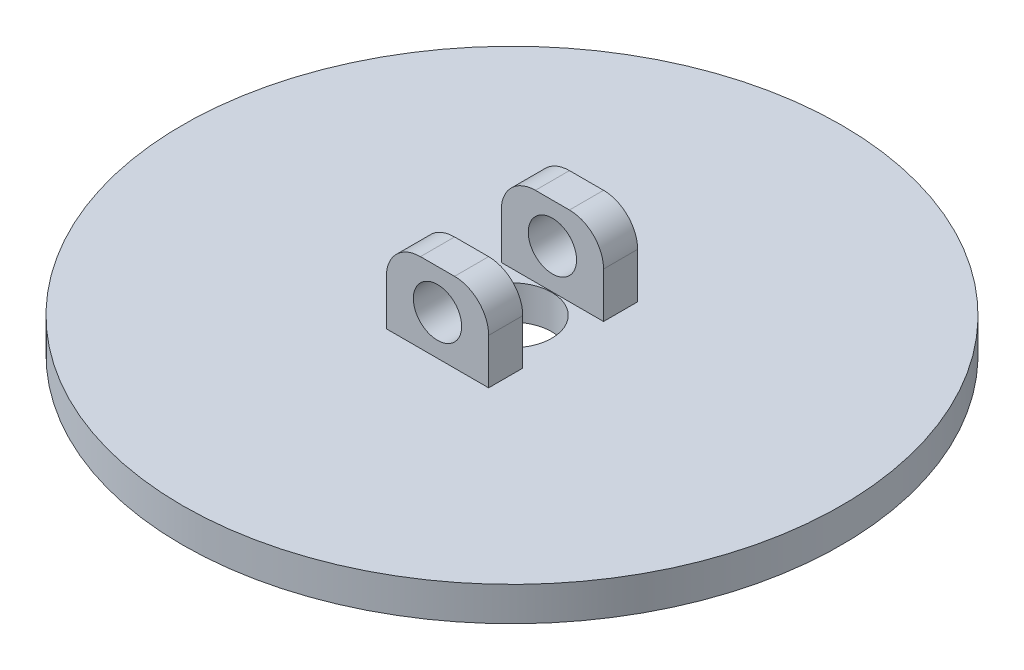
from build123d import *

# Parameters (mm, degrees)
SKETCH1_R               = 29
SKETCH1_R_2             = 3.5
BOSS_EXTRUDE1_DEPTH     = 3
SKETCH2_W               = 9
SKETCH2_H               = 3
BOSS_EXTRUDE2_DEPTH     = 7
CUT_EXTRUDE1_DEPTH      = 43.213741838
CUT_EXTRUDE1_DEPTH_BACK = 43.213741838
SKETCH4_R               = 2.125
CUT_EXTRUDE4_START      = -6.555610355
CUT_EXTRUDE4_DEPTH      = 13.11122071


# Read off the part's stored shape, not the designer's step: Cut-Extrude4
with BuildPart() as part:
    # Sketch1 → Boss-Extrude1 (new body)
    with BuildSketch(Plane(origin=(0, 0, 0), x_dir=(1, 0, 0), z_dir=(0, 1, 0))):
        with Locations(Location((0, 0, 0), (0, 0, 270))):
            Circle(SKETCH1_R)
        with Locations(Location((0, 0, 0), (0, 0, 270))):
            Circle(SKETCH1_R_2, mode=Mode.SUBTRACT)
    extrude(amount=BOSS_EXTRUDE1_DEPTH)

    # Sketch2 → Boss-Extrude2 (add)
    with BuildSketch(Plane(origin=(0, 3, 0), x_dir=(1, 0, 0), z_dir=(0, 1, 0))):
        with Locations((0, 5.055610355)):
            Rectangle(SKETCH2_W, SKETCH2_H)
        with Locations((0, -5.055610355)):
            Rectangle(SKETCH2_W, SKETCH2_H)
    extrude(amount=BOSS_EXTRUDE2_DEPTH)

    # Sketch4 → Cut-Extrude1 (cut, two sides: drawn at the far end of the back side and taken through both)
    with BuildSketch(Plane.XY.offset(-CUT_EXTRUDE1_DEPTH_BACK)):
        with Locations((0, 6.5)):
            Circle(SKETCH4_R)
    extrude(amount=CUT_EXTRUDE1_DEPTH + CUT_EXTRUDE1_DEPTH_BACK, mode=Mode.SUBTRACT)

    # Cut-Extrude4 outline → Cut-Extrude4 (cut)
    with BuildSketch(Plane.XY.offset(CUT_EXTRUDE4_START)):
        with BuildLine():
            Line((4.5, 10), (1.5, 10))
            ThreePointArc((1.5, 10), (3.621320344, 9.121320344), (4.5, 7))
            Line((4.5, 7), (4.5, 10))
        make_face()
        with BuildLine():
            ThreePointArc((-4.5, 7), (-3.621320344, 9.121320344), (-1.5, 10))
            Line((-1.5, 10), (-4.5, 10))
            Line((-4.5, 10), (-4.5, 7))
        make_face()
    extrude(amount=CUT_EXTRUDE4_DEPTH, mode=Mode.SUBTRACT)


solid = part.part
